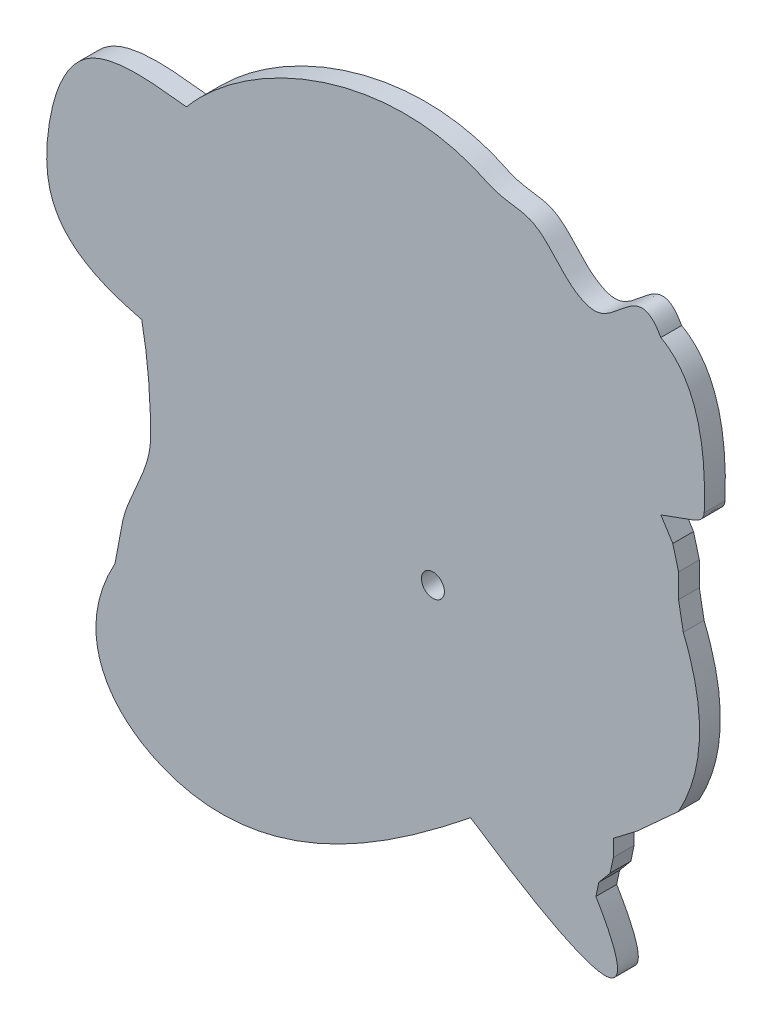
from build123d import *

# Parameters (mm, degrees)
SKETCH1_R           = 1.7526
BOSS_EXTRUDE2_DEPTH = 3.175


with BuildPart() as part:
    # Sketch1 → Boss-Extrude2 (new body)
    with BuildSketch(Plane.XY):
        with BuildLine():
            Line((158.848647409, 158.065989154), (159.287258197, 160.158039444))
            Line((159.287258197, 160.158039444), (161.024283069, 162.24246929))
            Line((161.024283069, 162.24246929), (161.51276424, 164.572387305))
            Line((161.51276424, 164.572387305), (161.51276424, 167.102297744))
            Line((161.51276424, 167.102297744), (165.183542032, 169.901250177))
            Line((165.183542032, 169.901250177), (171.472031107, 175.621746691))
            add(Edge.make_bspline(
                [(172.196352762, 199.687728108), (177.512545782, 186.611864968), (171.472031107, 175.621746691)],
                knots=[0, 0, 0, 1, 1, 1], degree=2))
            Line((172.196352762, 199.687728108), (171.472031107, 203.640454502))
            Line((171.472031107, 203.640454502), (171.472031107, 207.328620776))
            Line((171.472031107, 207.328620776), (170.591456875, 210.633600942))
            Line((170.591456875, 210.633600942), (168.77132287, 213.50749674))
            Line((168.77132287, 213.50749674), (173.762076079, 215.323183876))
            add(Edge.make_bspline(
                [(173.762076079, 215.323183876), (175.299052296, 215.889997376), (175.39725561, 217.089480705)],
                knots=[0, 0, 0, 1, 1, 1], degree=2))
            add(Edge.make_bspline(
                [(168.77132287, 236.972843892), (176.024535693, 232.91356426), (175.39725561, 217.089480705)],
                knots=[0, 0, 0, 1, 1, 1], degree=2))
            add(Edge.make_bspline(
                [(168.77132287, 236.972843892), (165.348333102, 243.181818321), (161.713024872, 233.590500252), (153.591853048, 237.311005477), (150.562230052, 243.292497992), (144.26627276, 243.172724883), (127.539588232, 251.709519765), (106.089408502, 242.945117572), (96.305367629, 231.252858967)],
                knots=[0, 0, 0, 0, 0.145953372, 0.187032347, 0.301264876, 0.367851833, 0.402074687, 1, 1, 1, 1], degree=3))
            add(Edge.make_bspline(
                [(89.47301913, 199.687728108), (76.414076731, 202.778398102), (72.921006176, 212.695352185), (79.130886224, 233.86725835), (92.35711514, 231.654519072), (96.305367629, 231.252858967)],
                knots=[0, 0, 0, 0, 0.435393148, 0.719886863, 1, 1, 1, 1], degree=3))
            add(Edge.make_bspline(
                [(89.47301913, 199.687728108), (90.449698127, 194.83749072), (90.825955315, 189.837761557), (90.838257386, 180.280743918), (87.678298822, 176.191377166), (86.590775441, 171.767770411)],
                knots=[0, 0, 0, 0, 0.517811069, 0.520823107, 1, 1, 1, 1], degree=3))
            Line((86.590775441, 171.767770411), (85.388246292, 165.381063893))
            add(Edge.make_bspline(
                [(85.388246292, 165.381063893), (78.04872596, 152.035766171), (100.062572602, 129.842406555), (127.319187547, 149.003850163), (139.710762388, 158.909562117)],
                knots=[0, 0, 0, 0, 0.355983936, 1, 1, 1, 1], degree=3))
            add(Edge.make_bspline(
                [(139.710762388, 158.909562117), (170.754327721, 138.111319354), (158.848647409, 158.065989154)],
                knots=[0, 0, 0, 1, 1, 1], degree=2))
        make_face()
        with Locations((133.949942357, 186.810985104)):
            Circle(SKETCH1_R, mode=Mode.SUBTRACT)
    extrude(amount=BOSS_EXTRUDE2_DEPTH)


solid = part.part
